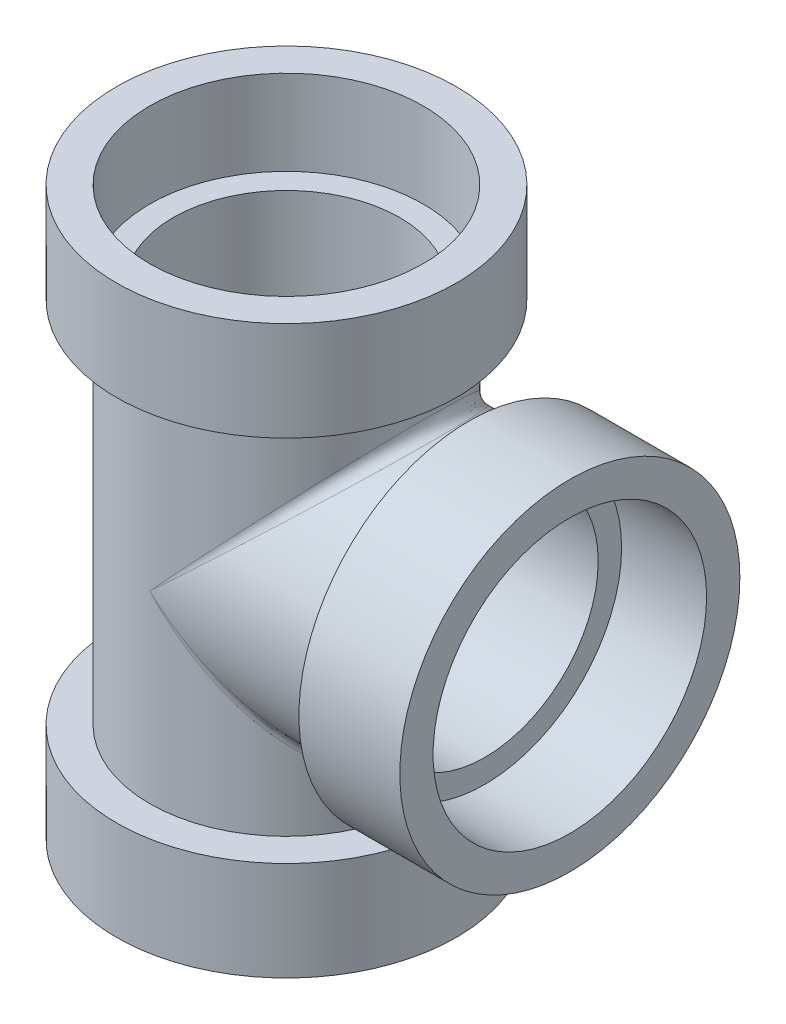
from build123d import *

# Parameters (mm, degrees)
CROQUIS1_R                 = 30
SALIENTE_EXTRUIR1_DEPTH    = 50
CROQUIS3_R                 = 24.13
CORTAR_EXTRUIR1_DEPTH      = 15
CORTAR_EXTRUIR2_START      = -85
CROQUIS3_2_R               = 24.13
CORTAR_EXTRUIR2_DEPTH      = 15
CROQUIS4_R                 = 30
CROQUIS4_R_2               = 24.13
CORTAR_EXTRUIR3_DEPTH      = 32.5
CROQUIS5_R                 = 24.13
SALIENTE_EXTRUIR2_DEPTH    = 50
CROQUIS6_R                 = 30
SALIENTE_EXTRUIR3_DEPTH    = 17.8
CORTAR_EXTRUIR4_START      = -15
CROQUIS7_R                 = 24.13
CORTAR_EXTRUIR4_DEPTH      = 15
CROQUIS9_R                 = 20
CORTAR_EXTRUIR5_DEPTH      = 104.07764064
REDONDEO1_R                = 2
CORTAR_EXTRUIR6_REACH      = 89.321
CORTAR_EXTRUIR6_END_RADIUS = 20
CROQUIS10_R                = 20


with BuildPart() as part:
    # Croquis1 → Saliente-Extruir1 (new, symmetric)
    with BuildSketch(Plane(origin=(0, 0, 0), x_dir=(1, 0, 0), z_dir=(0, 1, 0))):
        with Locations(Location((0, 0, 0), (0, 0, 90))):
            Circle(CROQUIS1_R)
    extrude(amount=SALIENTE_EXTRUIR1_DEPTH, both=True)

    # Croquis3 → Cortar-Extruir1 (cut)
    with BuildSketch(Plane(origin=(0, 50, 0), x_dir=(1, 0, 0), z_dir=(0, 1, 0))):
        with Locations(Location((0, 0, 0), (0, 0, 270))):
            Circle(CROQUIS3_R)
    extrude(amount=-CORTAR_EXTRUIR1_DEPTH, mode=Mode.SUBTRACT)

    # Croquis3<2> → Cortar-Extruir2 (cut)
    with BuildSketch(Plane(origin=(0, 50, 0), x_dir=(1, 0, 0), z_dir=(0, 1, 0)).offset(CORTAR_EXTRUIR2_START)):
        with Locations(Location((0, 0, 0), (0, 0, 270))):
            Circle(CROQUIS3_2_R)
    extrude(amount=-CORTAR_EXTRUIR2_DEPTH, mode=Mode.SUBTRACT)

    # Croquis4 → Cortar-Extruir3 (cut, symmetric)
    with BuildSketch(Plane(origin=(0, 0, 0), x_dir=(1, 0, 0), z_dir=(0, 1, 0))):
        with Locations(Location((0, 0, 0), (0, 0, 90))):
            Circle(CROQUIS4_R)
        with Locations(Location((0, 0, 0), (0, 0, 270))):
            Circle(CROQUIS4_R_2, mode=Mode.SUBTRACT)
    extrude(amount=CORTAR_EXTRUIR3_DEPTH, both=True, mode=Mode.SUBTRACT)

    # Croquis5 → Saliente-Extruir2 (add)
    with BuildSketch(Plane(origin=(0, 0, 0), x_dir=(0, 0, -1), z_dir=(1, 0, 0))):
        Circle(CROQUIS5_R)
    extrude(amount=SALIENTE_EXTRUIR2_DEPTH)

    # Croquis6 → Saliente-Extruir3 (add)
    with BuildSketch(Plane(origin=(50, 0, 0), x_dir=(0, 0, -1), z_dir=(1, 0, 0))):
        Circle(CROQUIS6_R)
    extrude(amount=-SALIENTE_EXTRUIR3_DEPTH)

    # Croquis7 → Cortar-Extruir4 (cut)
    with BuildSketch(Plane(origin=(50, 0, 0), x_dir=(0, 0, -1), z_dir=(1, 0, 0)).offset(CORTAR_EXTRUIR4_START)):
        Circle(CROQUIS7_R)
    extrude(amount=CORTAR_EXTRUIR4_DEPTH, mode=Mode.SUBTRACT)

    # Croquis9 → Cortar-Extruir5 (cut, through all)
    with BuildSketch(Plane.XZ.offset(35)):
        with Locations(Location((0, 0, 0), (0, 0, 270))):
            Circle(CROQUIS9_R)
    extrude(amount=-CORTAR_EXTRUIR5_DEPTH, mode=Mode.SUBTRACT)

    # Redondeo1
    redondeo1_edges = [part.edges().sort_by_distance(p)[0] for p in [
        (15.589160136, -15.589160136, -18.418332885),
        (24.13, 24.13, 2.6592e-05),
    ]]
    fillet(redondeo1_edges, radius=REDONDEO1_R)

    # Cortar-Extruir6: up to this cylinder (the profile starts outside it)
    cortar_extruir6_end = Plane(origin=(0, 0, 0), z_dir=(0, -1, 0)) * Cylinder(CORTAR_EXTRUIR6_END_RADIUS, 219.642, mode=Mode.PRIVATE)
    # Croquis10 → Cortar-Extruir6 (cut, up to the surface)
    with BuildSketch(Plane(origin=(35, 0, 0), x_dir=(0, 0, -1), z_dir=(1, 0, 0)), mode=Mode.PRIVATE) as cortar_extruir6_sk1:
        Circle(CROQUIS10_R)
    cortar_extruir6_tool1 = extrude(cortar_extruir6_sk1.sketch, amount=-CORTAR_EXTRUIR6_REACH, mode=Mode.PRIVATE) - cortar_extruir6_end
    add(cortar_extruir6_tool1.solids().sort_by_distance((35, 0, 0))[0], mode=Mode.SUBTRACT)


solid = part.part
